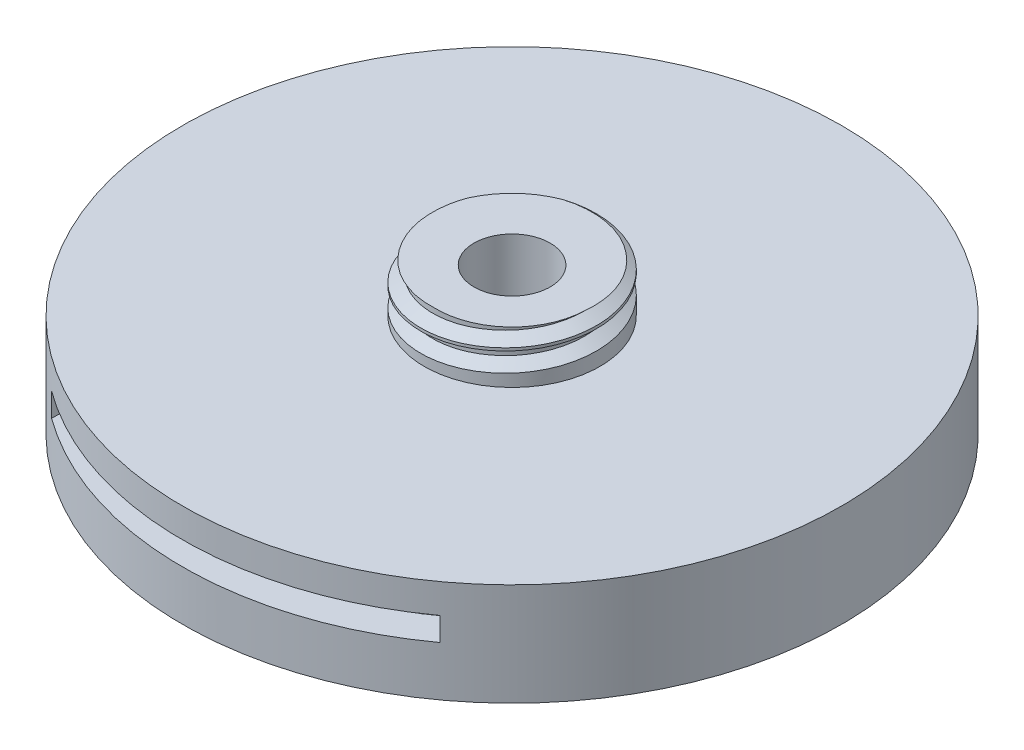
from build123d import *

# Parameters (mm, degrees)
SKIZZE1_R                            = 5
ZYLINDER_DEPTH                       = 2.2
SCHNITT_LINEAR_AUSTRAGEN1_DEPTH      = 10
SCHNITT_LINEAR_AUSTRAGEN1_DEPTH_BACK = 5
SKIZZE4_R                            = 4.5
SKIZZE6_R                            = 22.5
FASSUNG_OBJEKTTR_GERGEWINDE_DEPTH    = 7
SKIZZE11_R                           = 20.3
BOHRUNG_F_R_INNENGEWINDE_DEPTH       = 6
SKIZZE13_R                           = 6
AUFSATZ_LINEAR_AUSTRAGEN1_DEPTH      = 3
SKIZZE16_R                           = 2.6
SCHNITT_LINEAR_AUSTRAGEN13_DEPTH     = 10
GEWINDE1_PITCH                       = 1.5
SKIZZE17_W                           = 26.5
SKIZZE17_H                           = 49.541135346
SCHNITT_LINEAR_AUSTRAGEN14_DEPTH     = 1.6


with BuildPart() as part:
    # Skizze1 → Zylinder (new body)
    with BuildSketch(Plane(origin=(0, 0, 0), x_dir=(1, 0, 0), z_dir=(0, 1, 0))):
        with Locations(Location((-18.043745097, 0, 0), (0, 0, 270))):
            Circle(SKIZZE1_R)
    extrude(amount=ZYLINDER_DEPTH)

    # Skizze4 → Schnitt-Linear austragen1 (cut, two sides: drawn at the far end of the back side and taken through both)
    with BuildSketch(Plane(origin=(0, 2.2, 0), x_dir=(1, 0, 0), z_dir=(0, 1, 0)).offset(-SCHNITT_LINEAR_AUSTRAGEN1_DEPTH_BACK)):
        with Locations(Location((-18.043745097, 0, 0), (0, 0, 270))):
            Circle(SKIZZE4_R)
    extrude(amount=SCHNITT_LINEAR_AUSTRAGEN1_DEPTH + SCHNITT_LINEAR_AUSTRAGEN1_DEPTH_BACK, mode=Mode.SUBTRACT)

    # Skizze6 → Fassung Objektträgergewinde (add)
    with BuildSketch(Plane(origin=(0, 0, 0), x_dir=(-1, 0, 0), z_dir=(0, -1, 0))):
        with Locations(Location((18.043745097, 0, 0), (0, 0, 90))):
            Circle(SKIZZE6_R)
    extrude(amount=FASSUNG_OBJEKTTR_GERGEWINDE_DEPTH)

    # Skizze11 → Bohrung für Innengewinde (cut)
    with BuildSketch(Plane(origin=(0, -7, 0), x_dir=(-1, 0, 0), z_dir=(0, -1, 0))):
        with Locations(Location((18.043745097, 0, 0), (0, 0, 90))):
            Circle(SKIZZE11_R)
    extrude(amount=-BOHRUNG_F_R_INNENGEWINDE_DEPTH, mode=Mode.SUBTRACT)

    # Skizze13 → Aufsatz-Linear austragen1 (add)
    with BuildSketch(Plane(origin=(0, 0, 0), x_dir=(-1, 0, 0), z_dir=(0, -1, 0))):
        with Locations(Location((18.043745097, 0, 0), (0, 0, 90))):
            Circle(SKIZZE13_R)
    extrude(amount=-AUFSATZ_LINEAR_AUSTRAGEN1_DEPTH)

    # Skizze16 → Schnitt-Linear austragen13 (cut)
    with BuildSketch(Plane(origin=(0, -7, 0), x_dir=(-1, 0, 0), z_dir=(0, -1, 0))):
        with Locations(Location((18.043745097, 0, 0), (0, 0, 90))):
            Circle(SKIZZE16_R)
    extrude(amount=-SCHNITT_LINEAR_AUSTRAGEN13_DEPTH, mode=Mode.SUBTRACT)

    # Gewinde1: the profile of Gewindeprofil1 profile screwed along a right-hand helix of 2.333333 turns, 8 arcs to a turn; built about Z, then put on its axis
    gewinde1_z = Axis((0, 0, 0), (0, 0, 1))
    gewinde1_corners = [(6.0003, 0, -0.000173205), (6.0003, 0, 1.312673201), (5.188101187, 0, 0.843749998), (5.188101187, 0, 0.468749998)]
    with BuildLine(mode=Mode.PRIVATE) as gewinde1_profile:
        Line(gewinde1_corners[0], gewinde1_corners[1])
        Line(gewinde1_corners[1], gewinde1_corners[2])
        Line(gewinde1_corners[2], gewinde1_corners[3])
        Line(gewinde1_corners[3], gewinde1_corners[0])
    gewinde1_cap = Face(gewinde1_profile.wire())
    gewinde1_turn_angles = [0, 22.5, 45, 67.5, 90, 112.5, 135, 157.5, 180, 202.5, 225, 247.5, 270, 292.5, 315, 337.5, 360]
    gewinde1_turn_weights = [1, 0.9238795325112867, 1, 0.9238795325112867, 1, 0.9238795325112867, 1, 0.9238795325112867, 1, 0.9238795325112867, 1, 0.9238795325112867, 1, 0.9238795325112867, 1, 0.9238795325112867, 1]
    gewinde1_turn_rails = [Edge.make_bspline([Vector(p[0], p[1], 0).rotate(gewinde1_z, gewinde1_turn_angles[k]) / gewinde1_turn_weights[k] + Vector(0, 0, p[2] + GEWINDE1_PITCH * gewinde1_turn_angles[k] / 360) for k in range(17)], [0, 0, 0, 1, 1, 2, 2, 3, 3, 4, 4, 5, 5, 6, 6, 7, 7, 8, 8, 8], 2, gewinde1_turn_weights) for p in gewinde1_corners]
    gewinde1_turn_sides = [Face.make_surface_from_curves(gewinde1_turn_rails[p[0]], gewinde1_turn_rails[p[1]]) for p in [(0, 1), (1, 2), (2, 3), (3, 0)]]
    gewinde1_last_angles = [720, 742.5, 765, 787.5, 810, 825, 840]
    gewinde1_last_weights = [1, 0.9238795325112867, 1, 0.9238795325112867, 1, 0.9659258262890685, 1]
    gewinde1_last_rails = [Edge.make_bspline([Vector(p[0], p[1], 0).rotate(gewinde1_z, gewinde1_last_angles[k]) / gewinde1_last_weights[k] + Vector(0, 0, p[2] + GEWINDE1_PITCH * gewinde1_last_angles[k] / 360) for k in range(7)], [0, 0, 0, 1, 1, 2, 2, 3, 3, 3], 2, gewinde1_last_weights) for p in gewinde1_corners]
    gewinde1_last_sides = [Face.make_surface_from_curves(gewinde1_last_rails[p[0]], gewinde1_last_rails[p[1]]) for p in [(0, 1), (1, 2), (2, 3), (3, 0)]]
    gewinde1 = Plane(origin=(-18.043745097, 4.6, 0), x_dir=(-1, 0, 0), z_dir=(0, -1, 0)) * Solid(Shell([*[p.moved(Location((0, 0, GEWINDE1_PITCH * i))) for i in range(2) for p in gewinde1_turn_sides], *gewinde1_last_sides, gewinde1_cap, gewinde1_cap.rotate(gewinde1_z, 840).moved(Location((0, 0, GEWINDE1_PITCH * 840 / 360)))]))
    add(gewinde1, mode=Mode.SUBTRACT)

    # Skizze17 → Schnitt-Linear austragen14 (cut)
    with BuildSketch(Plane(origin=(0, -2, 0), x_dir=(1, 0, 0), z_dir=(0, 1, 0))):
        with Locations((-18.043745097, 0)):
            Rectangle(SKIZZE17_W, SKIZZE17_H)
    extrude(amount=-SCHNITT_LINEAR_AUSTRAGEN14_DEPTH, mode=Mode.SUBTRACT)


solid = part.part
